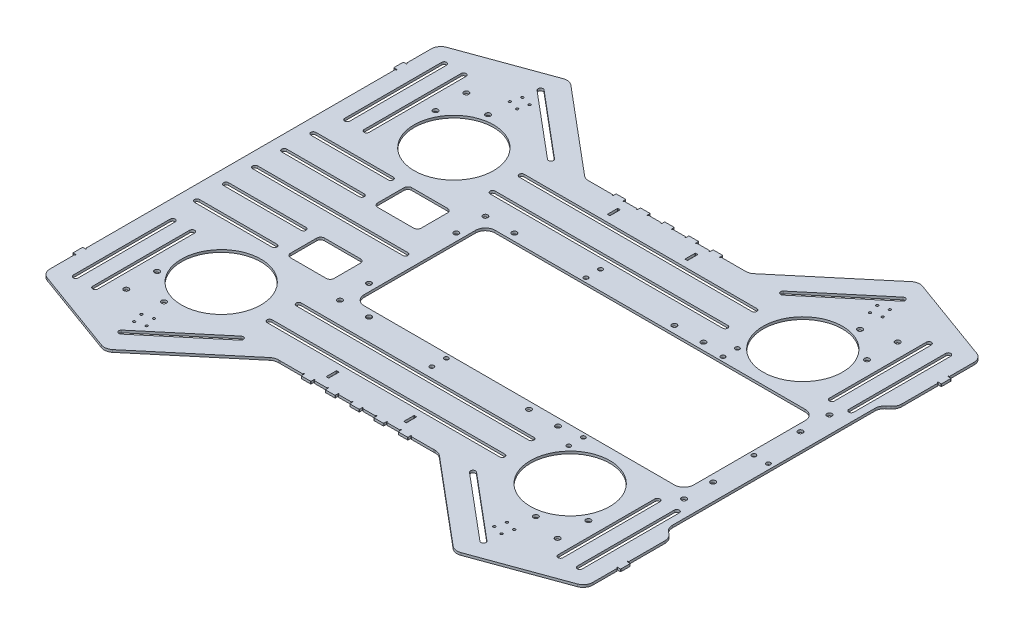
from build123d import *

# Parameters (mm, degrees)
SKETCH1_R                         = 1.575
SKETCH1_R_2                       = 52.07
SHEET_METAL_EXTRUDE_DEPTH         = 3.175
SHAPE_FILLET_R                    = 12.7
SKETCH2_R                         = 3.2639
PV_MOUNT_PATTERN_DEPTH            = 468.231899887
SKETCH3_R                         = 3.2639
THRUSTER_MOUNT_HOLE_PATTERN_DEPTH = 468.231899887
SKETCH5_W                         = 12.7
SKETCH5_H                         = 3.175
BOSS_EXTRUDE4_DEPTH               = 3.175
CUT_EXTRUDE3_DEPTH                = 468.231899887
LPATTERN1_COUNT                   = 5
LPATTERN1_PITCH                   = 31.75
MIRROR3_COPY_1_DEPTH              = 468.231899887
MIRROR3_COPY_2_DEPTH              = 468.231899887
MIRROR3_COPY_3_DEPTH              = 468.231899887
MIRROR3_COPY_4_DEPTH              = 468.231899887
FILLET_FOR_CUTTER_2_R             = 0.508
FILLET_FOR_CUTTER_R               = 0.508
CUT_EXTRUDE4_REACH                = 469.232
SKETCH8_W                         = 3.3528
SKETCH8_H                         = 13.716
FILLET3_R                         = 0.508
SKETCH9_W                         = 12.7
SKETCH9_H                         = 3.175
BOSS_EXTRUDE5_DEPTH               = 3.175
CUT_EXTRUDE5_DEPTH                = 3.175
MIRROR5_COPY_1_DEPTH              = 3.175
FILLET5_R                         = 0.508
SIDE_MOUNTING_SLOTS_DEPTH         = 470.652838698
BACK_MOUNTING_SLOTS_DEPTH         = 470.652838698
CUT_EXTRUDE8_DEPTH                = 470.652838698
MIRROR8_COPY_1_DEPTH              = 470.652838698
CUT_EXTRUDE9_DEPTH                = 470.652838698
CUT_EXTRUDE10_DEPTH               = 470.652838698
FILLET6_R                         = 0.254
FILLET6_OF_MIRROR9_R              = 0.254
MIRROR10_START                    = -1
MIRROR10_DEPTH                    = 5
CUT_EXTRUDE11_REACH               = 471.653
SKETCH16_R                        = 2.75
SCALE1_SCALE                      = 0.35


with BuildPart() as part:
    # Sketch1 → Sheet Metal Extrude (new body)
    with BuildSketch(Plane(origin=(0, 0, 0), x_dir=(1, 0, 0), z_dir=(0, 1, 0))):
        Polygon((-355.6, -258.575780248), (-228.6, -304.8), (-107.517834992, -203.2), (107.517834992, -203.2), (228.6, -304.8), (355.6, -258.575780248), (355.6, -149.225), (342.9, -138.568434684), (342.9, 138.568434684), (355.6, 149.225), (355.6, 258.575780248), (228.6, 304.8), (107.517834992, 203.2), (-107.517834992, 203.2), (-228.6, 304.8), (-355.6, 258.575780248), (-355.6, 149.225), (-355.6, -149.225), align=None)
        with Locations((-240.704026872, -254.319069628)):
            Circle(SKETCH1_R, mode=Mode.SUBTRACT)
        with Locations((-227.726785536, -250.841828292)):
            Circle(SKETCH1_R, mode=Mode.SUBTRACT)
        with Locations((-244.181268208, -241.341828292)):
            Circle(SKETCH1_R, mode=Mode.SUBTRACT)
        with Locations((-231.204026872, -237.864586956)):
            Circle(SKETCH1_R, mode=Mode.SUBTRACT)
        with Locations((-228.6, -152.4)):
            Circle(SKETCH1_R_2, mode=Mode.SUBTRACT)
        with Locations((227.726785536, -250.841828292)):
            Circle(SKETCH1_R, mode=Mode.SUBTRACT)
        with Locations((240.704026872, -254.319069628)):
            Circle(SKETCH1_R, mode=Mode.SUBTRACT)
        with Locations((244.181268208, -241.341828292)):
            Circle(SKETCH1_R, mode=Mode.SUBTRACT)
        with Locations((231.204026872, -237.864586956)):
            Circle(SKETCH1_R, mode=Mode.SUBTRACT)
        with Locations((228.6, -152.4)):
            Circle(SKETCH1_R_2, mode=Mode.SUBTRACT)
        with Locations((-228.6, 152.4)):
            Circle(SKETCH1_R_2, mode=Mode.SUBTRACT)
        with Locations((-231.204026872, 237.864586956)):
            Circle(SKETCH1_R, mode=Mode.SUBTRACT)
        with Locations((-244.181268208, 241.341828292)):
            Circle(SKETCH1_R, mode=Mode.SUBTRACT)
        with Locations((-240.704026872, 254.319069628)):
            Circle(SKETCH1_R, mode=Mode.SUBTRACT)
        with Locations((-227.726785536, 250.841828292)):
            Circle(SKETCH1_R, mode=Mode.SUBTRACT)
        with Locations((228.6, 152.4)):
            Circle(SKETCH1_R_2, mode=Mode.SUBTRACT)
        with Locations((231.204026872, 237.864586956)):
            Circle(SKETCH1_R, mode=Mode.SUBTRACT)
        with Locations((244.181268208, 241.341828292)):
            Circle(SKETCH1_R, mode=Mode.SUBTRACT)
        with Locations((227.726785536, 250.841828292)):
            Circle(SKETCH1_R, mode=Mode.SUBTRACT)
        with Locations((240.704026872, 254.319069628)):
            Circle(SKETCH1_R, mode=Mode.SUBTRACT)
    extrude(amount=SHEET_METAL_EXTRUDE_DEPTH)

    # Shape Fillet
    shape_fillet_edges = [part.edges().sort_by_distance(p)[0] for p in [
        (228.6, 1.5875, -304.8),
        (355.6, 1.5875, -258.575780248),
        (355.6, 1.5875, -149.225),
        (342.9, 1.5875, -138.568434684),
        (342.9, 1.5875, 138.568434684),
        (355.6, 1.5875, 149.225),
        (355.6, 1.5875, 258.575780248),
        (228.6, 1.5875, 304.8),
        (107.517834992, 1.5875, 203.2),
        (-107.517834992, 1.5875, 203.2),
        (-228.6, 1.5875, 304.8),
        (-355.6, 1.5875, 258.575780248),
        (-355.6, 1.5875, -258.575780248),
        (-228.6, 1.5875, -304.8),
        (-107.517834992, 1.5875, -203.2),
        (107.517834992, 1.5875, -203.2),
    ]]
    fillet(shape_fillet_edges, radius=SHAPE_FILLET_R)

    # Sketch2 → PV Mount Pattern (cut, through all)
    with BuildSketch(Plane(origin=(0, 3.175, 0), x_dir=(1, 0, 0), z_dir=(0, 1, 0))):
        with Locations(Location((320.675, 95.25, 0), (0, 0, 270))):
            Circle(SKETCH2_R)
        with Locations(Location((320.675, 57.15, 0), (0, 0, 270))):
            Circle(SKETCH2_R)
        with Locations(Location((155.575, 95.25, 0), (0, 0, 270))):
            Circle(SKETCH2_R)
        with Locations(Location((117.475, 95.25, 0), (0, 0, 270))):
            Circle(SKETCH2_R)
        with Locations(Location((-92.075, 95.25, 0), (0, 0, 270))):
            Circle(SKETCH2_R)
        with Locations(Location((-130.175, 95.25, 0), (0, 0, 270))):
            Circle(SKETCH2_R)
        with Locations(Location((-130.175, 57.15, 0), (0, 0, 270))):
            Circle(SKETCH2_R)
        with Locations(Location((320.675, -57.15, 0), (0, 0, 90))):
            Circle(SKETCH2_R)
        with Locations(Location((320.675, -95.25, 0), (0, 0, 90))):
            Circle(SKETCH2_R)
        with Locations(Location((155.575, -95.25, 0), (0, 0, 90))):
            Circle(SKETCH2_R)
        with Locations(Location((117.475, -95.25, 0), (0, 0, 90))):
            Circle(SKETCH2_R)
        with Locations(Location((-92.075, -95.25, 0), (0, 0, 90))):
            Circle(SKETCH2_R)
        with Locations(Location((-130.175, -95.25, 0), (0, 0, 90))):
            Circle(SKETCH2_R)
        with Locations(Location((-130.175, -57.15, 0), (0, 0, 90))):
            Circle(SKETCH2_R)
        with BuildLine():
            Line((-107.95, 85.725), (298.45, 85.725))
            ThreePointArc((298.45, 85.725), (307.430256121, 82.005256121), (311.15, 73.025))
            Line((311.15, 73.025), (311.15, -73.025))
            ThreePointArc((311.15, -73.025), (307.430256121, -82.005256121), (298.45, -85.725))
            Line((298.45, -85.725), (-107.95, -85.725))
            ThreePointArc((-107.95, -85.725), (-116.930256121, -82.005256121), (-120.65, -73.025))
            Line((-120.65, -73.025), (-120.65, 73.025))
            ThreePointArc((-120.65, 73.025), (-116.930256121, 82.005256121), (-107.95, 85.725))
        make_face()
    extrude(amount=-PV_MOUNT_PATTERN_DEPTH, mode=Mode.SUBTRACT)

    # Sketch3 → Thruster Mount Hole Pattern (cut, through all)
    with BuildSketch(Plane(origin=(0, 3.175, 0), x_dir=(1, 0, 0), z_dir=(0, 1, 0))):
        with Locations(Location((282.589529262, 222.760524402, 0), (0, 0, 270))):
            Circle(SKETCH3_R)
        with Locations(Location((-282.589529262, 222.760524402, 0), (0, 0, 270))):
            Circle(SKETCH3_R)
        with Locations(Location((282.589529262, -222.760524402, 0), (0, 0, 90))):
            Circle(SKETCH3_R)
        with Locations(Location((-282.589529262, -222.760524402, 0), (0, 0, 90))):
            Circle(SKETCH3_R)
        with Locations(Location((282.589529262, 182.458174715, 0), (0, 0, 270))):
            Circle(SKETCH3_R)
        with Locations(Location((243.660448839, 212.329508741, 0), (0, 0, 270))):
            Circle(SKETCH3_R)
        with Locations(Location((-243.660448839, 212.329508741, 0), (0, 0, 270))):
            Circle(SKETCH3_R)
        with Locations(Location((-282.589529262, 182.458174715, 0), (0, 0, 270))):
            Circle(SKETCH3_R)
        with Locations(Location((243.660448839, -212.329508741, 0), (0, 0, 90))):
            Circle(SKETCH3_R)
        with Locations(Location((282.589529262, -182.458174715, 0), (0, 0, 90))):
            Circle(SKETCH3_R)
        with Locations(Location((-282.589529262, -182.458174715, 0), (0, 0, 90))):
            Circle(SKETCH3_R)
        with Locations(Location((-243.660448839, -212.329508741, 0), (0, 0, 90))):
            Circle(SKETCH3_R)
    extrude(amount=-THRUSTER_MOUNT_HOLE_PATTERN_DEPTH, mode=Mode.SUBTRACT)

    # Sketch5 → Boss-Extrude4 (add)
    with BuildSketch(Plane.XY.offset(203.2)):
        with Locations((0, 1.5875)):
            Rectangle(SKETCH5_W, SKETCH5_H)
        with Locations((31.75, 1.5875)):
            Rectangle(SKETCH5_W, SKETCH5_H)
        with Locations((63.5, 1.5875)):
            Rectangle(SKETCH5_W, SKETCH5_H)
        with Locations((-31.75, 1.5875)):
            Rectangle(SKETCH5_W, SKETCH5_H)
        with Locations((-63.5, 1.5875)):
            Rectangle(SKETCH5_W, SKETCH5_H)
    boss_extrude4 = extrude(amount=BOSS_EXTRUDE4_DEPTH)

    # Mirror2: Boss-Extrude4 across plane
    add(boss_extrude4.mirror(Plane.XY))

    # Sketch6 → Cut-Extrude3 (cut, through all)
    with BuildSketch(Plane(origin=(0, 3.175, 0), x_dir=(1, 0, 0), z_dir=(0, 1, 0))):
        with BuildLine():
            Line((69.85, 202.438), (69.85, 203.2))
            Line((69.85, 203.2), (70.866, 203.2))
            Line((70.866, 203.2), (70.866, 202.438))
            ThreePointArc((70.866, 202.438), (70.358, 201.93), (69.85, 202.438))
        make_face()
        with BuildLine():
            Line((56.134, 202.438), (56.134, 203.2))
            Line((56.134, 203.2), (57.15, 203.2))
            Line((57.15, 203.2), (57.15, 202.438))
            ThreePointArc((57.15, 202.438), (56.642, 201.93), (56.134, 202.438))
        make_face()
    cut_extrude3 = extrude(amount=-CUT_EXTRUDE3_DEPTH, mode=Mode.SUBTRACT)

    # LPattern1: Cut-Extrude3 ×5
    with Locations(*[(-i * LPATTERN1_PITCH, 0, 0) for i in range(1, LPATTERN1_COUNT)]):
        add(cut_extrude3, mode=Mode.SUBTRACT)

    # Mirror3: Cut-Extrude3 across plane
    add(cut_extrude3.mirror(Plane.XY), mode=Mode.SUBTRACT)

    # Mirror3 copy 1 sketch → Mirror3 copy 1 (cut, through all)
    with BuildSketch(Plane(origin=(-31.75, 3.175, 0), x_dir=(1, 0, 0), z_dir=(0, 1, 0))):
        with BuildLine():
            Line((69.85, -202.438), (69.85, -203.2))
            Line((69.85, -203.2), (70.866, -203.2))
            Line((70.866, -203.2), (70.866, -202.438))
            ThreePointArc((70.866, -202.438), (70.358, -201.93), (69.85, -202.438))
        make_face()
        with BuildLine():
            Line((56.134, -202.438), (56.134, -203.2))
            Line((56.134, -203.2), (57.15, -203.2))
            Line((57.15, -203.2), (57.15, -202.438))
            ThreePointArc((57.15, -202.438), (56.642, -201.93), (56.134, -202.438))
        make_face()
    extrude(amount=-MIRROR3_COPY_1_DEPTH, mode=Mode.SUBTRACT)

    # Mirror3 copy 2 sketch → Mirror3 copy 2 (cut, through all)
    with BuildSketch(Plane(origin=(-63.5, 3.175, 0), x_dir=(1, 0, 0), z_dir=(0, 1, 0))):
        with BuildLine():
            Line((69.85, -202.438), (69.85, -203.2))
            Line((69.85, -203.2), (70.866, -203.2))
            Line((70.866, -203.2), (70.866, -202.438))
            ThreePointArc((70.866, -202.438), (70.358, -201.93), (69.85, -202.438))
        make_face()
        with BuildLine():
            Line((56.134, -202.438), (56.134, -203.2))
            Line((56.134, -203.2), (57.15, -203.2))
            Line((57.15, -203.2), (57.15, -202.438))
            ThreePointArc((57.15, -202.438), (56.642, -201.93), (56.134, -202.438))
        make_face()
    extrude(amount=-MIRROR3_COPY_2_DEPTH, mode=Mode.SUBTRACT)

    # Mirror3 copy 3 sketch → Mirror3 copy 3 (cut, through all)
    with BuildSketch(Plane(origin=(-95.25, 3.175, 0), x_dir=(1, 0, 0), z_dir=(0, 1, 0))):
        with BuildLine():
            Line((69.85, -202.438), (69.85, -203.2))
            Line((69.85, -203.2), (70.866, -203.2))
            Line((70.866, -203.2), (70.866, -202.438))
            ThreePointArc((70.866, -202.438), (70.358, -201.93), (69.85, -202.438))
        make_face()
        with BuildLine():
            Line((56.134, -202.438), (56.134, -203.2))
            Line((56.134, -203.2), (57.15, -203.2))
            Line((57.15, -203.2), (57.15, -202.438))
            ThreePointArc((57.15, -202.438), (56.642, -201.93), (56.134, -202.438))
        make_face()
    extrude(amount=-MIRROR3_COPY_3_DEPTH, mode=Mode.SUBTRACT)

    # Mirror3 copy 4 sketch → Mirror3 copy 4 (cut, through all)
    with BuildSketch(Plane(origin=(-127, 3.175, 0), x_dir=(1, 0, 0), z_dir=(0, 1, 0))):
        with BuildLine():
            Line((69.85, -202.438), (69.85, -203.2))
            Line((69.85, -203.2), (70.866, -203.2))
            Line((70.866, -203.2), (70.866, -202.438))
            ThreePointArc((70.866, -202.438), (70.358, -201.93), (69.85, -202.438))
        make_face()
        with BuildLine():
            Line((56.134, -202.438), (56.134, -203.2))
            Line((56.134, -203.2), (57.15, -203.2))
            Line((57.15, -203.2), (57.15, -202.438))
            ThreePointArc((57.15, -202.438), (56.642, -201.93), (56.134, -202.438))
        make_face()
    extrude(amount=-MIRROR3_COPY_4_DEPTH, mode=Mode.SUBTRACT)

    # Fillet for Cutter 2
    fillet_for_cutter_2_edges = [part.edges().sort_by_distance(p)[0] for p in [
        (-6.35, 1.5875, 206.375),
        (6.35, 1.5875, 206.375),
        (-38.1, 1.5875, 206.375),
        (-25.4, 1.5875, 206.375),
        (25.4, 1.5875, 206.375),
        (38.1, 1.5875, 206.375),
        (57.15, 1.5875, 206.375),
        (69.85, 1.5875, 206.375),
        (-69.85, 1.5875, 206.375),
        (-57.15, 1.5875, 206.375),
        (70.866, 1.5875, 203.2),
        (56.134, 1.5875, 203.2),
        (39.116, 1.5875, 203.2),
        (24.384, 1.5875, 203.2),
        (7.366, 1.5875, 203.2),
        (-7.366, 1.5875, 203.2),
        (-24.384, 1.5875, 203.2),
        (-39.116, 1.5875, 203.2),
        (-56.134, 1.5875, 203.2),
        (-70.866, 1.5875, 203.2),
    ]]
    fillet(fillet_for_cutter_2_edges, radius=FILLET_FOR_CUTTER_2_R)

    # Fillet for Cutter
    fillet_for_cutter_edges = [part.edges().sort_by_distance(p)[0] for p in [
        (-6.35, 1.5875, -206.375),
        (6.35, 1.5875, -206.375),
        (-25.4, 1.5875, -206.375),
        (-38.1, 1.5875, -206.375),
        (38.1, 1.5875, -206.375),
        (25.4, 1.5875, -206.375),
        (69.85, 1.5875, -206.375),
        (57.15, 1.5875, -206.375),
        (-57.15, 1.5875, -206.375),
        (-69.85, 1.5875, -206.375),
        (70.866, 1.5875, -203.2),
        (56.134, 1.5875, -203.2),
        (39.116, 1.5875, -203.2),
        (24.384, 1.5875, -203.2),
        (-7.366, 1.5875, -203.2),
        (-24.384, 1.5875, -203.2),
        (-39.116, 1.5875, -203.2),
        (-56.134, 1.5875, -203.2),
        (-70.866, 1.5875, -203.2),
    ]]
    fillet(fillet_for_cutter_edges, radius=FILLET_FOR_CUTTER_R)

    # Sketch8 → Cut-Extrude4 (cut, up to next)
    with BuildSketch(Plane(origin=(0, 3.175, 0), x_dir=(1, 0, 0), z_dir=(0, 1, 0)), mode=Mode.PRIVATE) as cut_extrude4_sk1:
        with Locations((50.8, 184.15)):
            Rectangle(SKETCH8_W, SKETCH8_H)
    cut_extrude4_tool1 = extrude(cut_extrude4_sk1.sketch, amount=-CUT_EXTRUDE4_REACH, mode=Mode.PRIVATE) & part.part
    # Sketch8 → Cut-Extrude4 (cut, up to next)
    with BuildSketch(Plane(origin=(0, 3.175, 0), x_dir=(1, 0, 0), z_dir=(0, 1, 0)), mode=Mode.PRIVATE) as cut_extrude4_sk2:
        with Locations((-50.8, 184.15)):
            Rectangle(SKETCH8_W, SKETCH8_H)
    cut_extrude4_tool2 = extrude(cut_extrude4_sk2.sketch, amount=-CUT_EXTRUDE4_REACH, mode=Mode.PRIVATE) & part.part
    # Sketch8 → Cut-Extrude4 (cut, up to next)
    with BuildSketch(Plane(origin=(0, 3.175, 0), x_dir=(1, 0, 0), z_dir=(0, 1, 0)), mode=Mode.PRIVATE) as cut_extrude4_sk3:
        with Locations((-50.8, -184.15)):
            Rectangle(SKETCH8_W, SKETCH8_H)
    cut_extrude4_tool3 = extrude(cut_extrude4_sk3.sketch, amount=-CUT_EXTRUDE4_REACH, mode=Mode.PRIVATE) & part.part
    # Sketch8 → Cut-Extrude4 (cut, up to next)
    with BuildSketch(Plane(origin=(0, 3.175, 0), x_dir=(1, 0, 0), z_dir=(0, 1, 0)), mode=Mode.PRIVATE) as cut_extrude4_sk4:
        with Locations((50.8, -184.15)):
            Rectangle(SKETCH8_W, SKETCH8_H)
    cut_extrude4_tool4 = extrude(cut_extrude4_sk4.sketch, amount=-CUT_EXTRUDE4_REACH, mode=Mode.PRIVATE) & part.part
    add(cut_extrude4_tool1.solids().sort_by_distance((50.8, 3.175, -184.15))[0], mode=Mode.SUBTRACT)
    add(cut_extrude4_tool2.solids().sort_by_distance((-50.8, 3.175, -184.15))[0], mode=Mode.SUBTRACT)
    add(cut_extrude4_tool3.solids().sort_by_distance((-50.8, 3.175, 184.15))[0], mode=Mode.SUBTRACT)
    add(cut_extrude4_tool4.solids().sort_by_distance((50.8, 3.175, 184.15))[0], mode=Mode.SUBTRACT)

    # Fillet3
    fillet3_edges = [part.edges().sort_by_distance(p)[0] for p in [
        (52.4764, 1.5875, 177.292),
        (52.4764, 1.5875, 191.008),
        (49.1236, 1.5875, 191.008),
        (49.1236, 1.5875, 177.292),
        (-52.4764, 1.5875, 191.008),
        (-52.4764, 1.5875, 177.292),
        (-49.1236, 1.5875, 177.292),
        (-49.1236, 1.5875, 191.008),
        (-52.4764, 1.5875, -177.292),
        (-52.4764, 1.5875, -191.008),
        (-49.1236, 1.5875, -191.008),
        (-49.1236, 1.5875, -177.292),
        (49.1236, 1.5875, -177.292),
        (49.1236, 1.5875, -191.008),
        (52.4764, 1.5875, -191.008),
        (52.4764, 1.5875, -177.292),
    ]]
    fillet(fillet3_edges, radius=FILLET3_R)

    # Sketch9 → Boss-Extrude5 (add)
    with BuildSketch(Plane(origin=(355.6, 0, 0), x_dir=(0, 0, -1), z_dir=(1, 0, 0))):
        with Locations((210.058, 1.5875)):
            Rectangle(SKETCH9_W, SKETCH9_H)
        with Locations((-210.058, 1.5875)):
            Rectangle(SKETCH9_W, SKETCH9_H)
    boss_extrude5 = extrude(amount=BOSS_EXTRUDE5_DEPTH)

    # Sketch10 → Cut-Extrude5 (cut)
    with BuildSketch(Plane(origin=(0, 3.175, 0), x_dir=(1, 0, 0), z_dir=(0, 1, 0))):
        with BuildLine():
            Line((354.838, -217.424), (355.6, -217.424))
            Line((355.6, -217.424), (355.6, -216.408))
            Line((355.6, -216.408), (354.838, -216.408))
            ThreePointArc((354.838, -216.408), (354.33, -216.916), (354.838, -217.424))
        make_face()
        with BuildLine():
            Line((354.838, -202.692), (355.6, -202.692))
            Line((355.6, -202.692), (355.6, -203.708))
            Line((355.6, -203.708), (354.838, -203.708))
            ThreePointArc((354.838, -203.708), (354.33, -203.2), (354.838, -202.692))
        make_face()
    cut_extrude5 = extrude(amount=-CUT_EXTRUDE5_DEPTH, mode=Mode.SUBTRACT)

    # Mirror4: Cut-Extrude5 across plane
    add(cut_extrude5.mirror(Plane.XY), mode=Mode.SUBTRACT)

    # Mirror5: Boss-Extrude5, Cut-Extrude5 across plane
    add(boss_extrude5.mirror(Plane(origin=(0, 0, 0), x_dir=(0, 0, 1), z_dir=(1, 0, 0))))
    add(cut_extrude5.mirror(Plane(origin=(0, 0, 0), x_dir=(0, 0, 1), z_dir=(1, 0, 0))), mode=Mode.SUBTRACT)

    # Mirror5 copy 1 sketch → Mirror5 copy 1 (cut)
    with BuildSketch(Plane(origin=(0, 3.175, 0), x_dir=(-1, 0, 0), z_dir=(0, 1, 0))):
        with BuildLine():
            Line((354.838, -217.424), (355.6, -217.424))
            Line((355.6, -217.424), (355.6, -216.408))
            Line((355.6, -216.408), (354.838, -216.408))
            ThreePointArc((354.838, -216.408), (354.33, -216.916), (354.838, -217.424))
        make_face()
        with BuildLine():
            Line((354.838, -202.692), (355.6, -202.692))
            Line((355.6, -202.692), (355.6, -203.708))
            Line((355.6, -203.708), (354.838, -203.708))
            ThreePointArc((354.838, -203.708), (354.33, -203.2), (354.838, -202.692))
        make_face()
    extrude(amount=-MIRROR5_COPY_1_DEPTH, mode=Mode.SUBTRACT)

    # Fillet5
    fillet5_edges = [part.edges().sort_by_distance(p)[0] for p in [
        (358.775, 1.5875, -203.708),
        (358.775, 1.5875, -216.408),
        (358.775, 1.5875, 216.408),
        (358.775, 1.5875, 203.708),
        (355.6, 1.5875, 217.424),
        (355.6, 1.5875, 202.692),
        (355.6, 1.5875, -217.424),
        (355.6, 1.5875, -202.692),
        (-358.775, 1.5875, -203.708),
        (-358.775, 1.5875, -216.408),
        (-358.775, 1.5875, 203.708),
        (-358.775, 1.5875, 216.408),
        (-355.6, 1.5875, 217.424),
        (-355.6, 1.5875, 202.692),
        (-355.6, 1.5875, -217.424),
        (-355.6, 1.5875, -202.692),
    ]]
    fillet(fillet5_edges, radius=FILLET5_R)

    # Sketch11 → Side Mounting Slots (cut, through all)
    with BuildSketch(Plane(origin=(0, 3.175, 0), x_dir=(1, 0, 0), z_dir=(0, 1, 0))):
        with BuildLine():
            Line((152.4, 168.3639), (-152.4, 168.3639))
            ThreePointArc((-152.4, 168.3639), (-155.6639, 165.1), (-152.4, 161.8361))
            Line((-152.4, 161.8361), (152.4, 161.8361))
            ThreePointArc((152.4, 161.8361), (155.6639, 165.1), (152.4, 168.3639))
        make_face()
        with BuildLine():
            Line((-152.4, 123.7361), (152.4, 123.7361))
            ThreePointArc((152.4, 123.7361), (155.6639, 127), (152.4, 130.2639))
            Line((152.4, 130.2639), (-152.4, 130.2639))
            ThreePointArc((-152.4, 130.2639), (-155.6639, 127), (-152.4, 123.7361))
        make_face()
    side_mounting_slots = extrude(amount=-SIDE_MOUNTING_SLOTS_DEPTH, mode=Mode.SUBTRACT)

    # Mirror6: Side Mounting Slots across plane
    add(side_mounting_slots.mirror(Plane.XY), mode=Mode.SUBTRACT)

    # Sketch12 → Back Mounting Slots (cut, through all)
    with BuildSketch(Plane(origin=(0, 3.175, 0), x_dir=(1, 0, 0), z_dir=(0, 1, 0))):
        with BuildLine():
            Line((-139.7, -3.2639), (-336.55, -3.2639))
            ThreePointArc((-336.55, -3.2639), (-339.8139, 0), (-336.55, 3.2639))
            Line((-336.55, 3.2639), (-139.7, 3.2639))
            ThreePointArc((-139.7, 3.2639), (-136.4361, 0), (-139.7, -3.2639))
        make_face()
        with BuildLine():
            Line((-215.9, -74.3839), (-215.9, -39.9161))
            ThreePointArc((-215.9, -39.9161), (-214.412102448, -36.323997552), (-210.82, -34.8361))
            Line((-210.82, -34.8361), (-163.83, -34.8361))
            ThreePointArc((-163.83, -34.8361), (-160.237897552, -36.323997552), (-158.75, -39.9161))
            Line((-158.75, -39.9161), (-158.75, -74.3839))
            ThreePointArc((-158.75, -74.3839), (-160.237897552, -77.976002448), (-163.83, -79.4639))
            Line((-163.83, -79.4639), (-210.82, -79.4639))
            ThreePointArc((-210.82, -79.4639), (-214.412102448, -77.976002448), (-215.9, -74.3839))
        make_face()
        with BuildLine():
            Line((-336.55, 41.3639), (-234.95, 41.3639))
            ThreePointArc((-234.95, 41.3639), (-231.6861, 38.1), (-234.95, 34.8361))
            Line((-234.95, 34.8361), (-336.55, 34.8361))
            ThreePointArc((-336.55, 34.8361), (-339.8139, 38.1), (-336.55, 41.3639))
        make_face()
        with BuildLine():
            Line((-336.55, 79.4639), (-234.95, 79.4639))
            ThreePointArc((-234.95, 79.4639), (-231.6861, 76.2), (-234.95, 72.9361))
            Line((-234.95, 72.9361), (-336.55, 72.9361))
            ThreePointArc((-336.55, 72.9361), (-339.8139, 76.2), (-336.55, 79.4639))
        make_face()
        with BuildLine():
            Line((-336.55, -41.3639), (-234.95, -41.3639))
            ThreePointArc((-234.95, -41.3639), (-231.6861, -38.1), (-234.95, -34.8361))
            Line((-234.95, -34.8361), (-336.55, -34.8361))
            ThreePointArc((-336.55, -34.8361), (-339.8139, -38.1), (-336.55, -41.3639))
        make_face()
        with BuildLine():
            Line((-336.55, -72.9361), (-234.95, -72.9361))
            ThreePointArc((-234.95, -72.9361), (-231.6861, -76.2), (-234.95, -79.4639))
            Line((-234.95, -79.4639), (-336.55, -79.4639))
            ThreePointArc((-336.55, -79.4639), (-339.8139, -76.2), (-336.55, -72.9361))
        make_face()
        with BuildLine():
            Line((-163.83, 79.4639), (-210.82, 79.4639))
            ThreePointArc((-210.82, 79.4639), (-214.412102448, 77.976002448), (-215.9, 74.3839))
            Line((-215.9, 74.3839), (-215.9, 39.9161))
            ThreePointArc((-215.9, 39.9161), (-214.412102448, 36.323997552), (-210.82, 34.8361))
            Line((-210.82, 34.8361), (-163.83, 34.8361))
            ThreePointArc((-163.83, 34.8361), (-160.237897552, 36.323997552), (-158.75, 39.9161))
            Line((-158.75, 39.9161), (-158.75, 74.3839))
            ThreePointArc((-158.75, 74.3839), (-160.237897552, 77.976002448), (-163.83, 79.4639))
        make_face()
    extrude(amount=-BACK_MOUNTING_SLOTS_DEPTH, mode=Mode.SUBTRACT)

    # Sketch13 → Cut-Extrude8 (cut, through all)
    with BuildSketch(Plane.XZ):
        with BuildLine():
            Line((-326.9361, 241.3), (-326.9361, 114.3))
            ThreePointArc((-326.9361, 114.3), (-330.2, 111.0361), (-333.4639, 114.3))
            Line((-333.4639, 114.3), (-333.4639, 241.3))
            ThreePointArc((-333.4639, 241.3), (-330.2, 244.5639), (-326.9361, 241.3))
        make_face()
        with BuildLine():
            Line((-308.0639, 241.3), (-308.0639, 114.3))
            ThreePointArc((-308.0639, 114.3), (-304.8, 111.0361), (-301.5361, 114.3))
            Line((-301.5361, 114.3), (-301.5361, 241.3))
            ThreePointArc((-301.5361, 241.3), (-304.8, 244.5639), (-308.0639, 241.3))
        make_face()
    cut_extrude8 = extrude(amount=-CUT_EXTRUDE8_DEPTH, mode=Mode.SUBTRACT)

    # Mirror7: Cut-Extrude8 across plane
    add(cut_extrude8.mirror(Plane(origin=(0, 0, 0), x_dir=(0, 0, 1), z_dir=(1, 0, 0))), mode=Mode.SUBTRACT)

    # Mirror8: Cut-Extrude8 across plane
    add(cut_extrude8.mirror(Plane.XY), mode=Mode.SUBTRACT)

    # Mirror8 copy 1 sketch → Mirror8 copy 1 (cut, through all)
    with BuildSketch(Plane(origin=(0, 0, 0), x_dir=(-1, 0, 0), z_dir=(0, -1, 0))):
        with BuildLine():
            Line((-326.9361, 241.3), (-326.9361, 114.3))
            ThreePointArc((-326.9361, 114.3), (-330.2, 111.0361), (-333.4639, 114.3))
            Line((-333.4639, 114.3), (-333.4639, 241.3))
            ThreePointArc((-333.4639, 241.3), (-330.2, 244.5639), (-326.9361, 241.3))
        make_face()
        with BuildLine():
            Line((-308.0639, 241.3), (-308.0639, 114.3))
            ThreePointArc((-308.0639, 114.3), (-304.8, 111.0361), (-301.5361, 114.3))
            Line((-301.5361, 114.3), (-301.5361, 241.3))
            ThreePointArc((-301.5361, 241.3), (-304.8, 244.5639), (-308.0639, 241.3))
        make_face()
    extrude(amount=-MIRROR8_COPY_1_DEPTH, mode=Mode.SUBTRACT)

    # Sketch14 → Cut-Extrude9 (cut, through all)
    with BuildSketch(Plane(origin=(0, 0, 0), x_dir=(-1, 0, 0), z_dir=(0, -1, 0))):
        with BuildLine():
            Line((-235.136540287, 277.127463395), (-150.012952714, 205.700292458))
            ThreePointArc((-150.012952714, 205.700292458), (-149.610654735, 201.102005521), (-154.208941672, 200.699707542))
            Line((-154.208941672, 200.699707542), (-239.332529246, 272.126878479))
            ThreePointArc((-239.332529246, 272.126878479), (-239.734827224, 276.725165417), (-235.136540287, 277.127463395))
        make_face()
        with BuildLine():
            Line((-239.332529246, -272.126878479), (-154.208941672, -200.699707542))
            ThreePointArc((-154.208941672, -200.699707542), (-149.610654735, -201.102005521), (-150.012952714, -205.700292458))
            Line((-150.012952714, -205.700292458), (-235.136540287, -277.127463395))
            ThreePointArc((-235.136540287, -277.127463395), (-239.734827224, -276.725165417), (-239.332529246, -272.126878479))
        make_face()
        with BuildLine():
            Line((235.136540287, -277.127463395), (150.012952714, -205.700292458))
            ThreePointArc((150.012952714, -205.700292458), (149.610654735, -201.102005521), (154.208941672, -200.699707542))
            Line((154.208941672, -200.699707542), (239.332529246, -272.126878479))
            ThreePointArc((239.332529246, -272.126878479), (239.734827224, -276.725165417), (235.136540287, -277.127463395))
        make_face()
        with BuildLine():
            Line((239.332529246, 272.126878479), (154.208941672, 200.699707542))
            ThreePointArc((154.208941672, 200.699707542), (149.610654735, 201.102005521), (150.012952714, 205.700292458))
            Line((150.012952714, 205.700292458), (235.136540287, 277.127463395))
            ThreePointArc((235.136540287, 277.127463395), (239.734827224, 276.725165417), (239.332529246, 272.126878479))
        make_face()
    extrude(amount=-CUT_EXTRUDE9_DEPTH, mode=Mode.SUBTRACT)

    # Sketch15 → Cut-Extrude10 (cut, through all)
    with BuildSketch(Plane(origin=(0, 3.175, 0), x_dir=(1, 0, 0), z_dir=(0, 1, 0))):
        Polygon((100.084767464, 203.2), (101.608767464, 202.9968), (101.608767464, 203.2), align=None)
    cut_extrude10 = extrude(amount=-CUT_EXTRUDE10_DEPTH, mode=Mode.SUBTRACT)

    # Fillet6
    # the kernel refuses this fillet: 0.254 mm, written as the material it adds along each edge
    with BuildSketch(Plane(origin=(101.608767464, 3.175, -202.9968), x_dir=(-0.9912279006826319, 0, -0.13216372009103824), z_dir=(0, -1, 0))) as fillet6_piece_1:
        with BuildLine():
            CenterArc((0.275353317, 0.254), FILLET6_R, 191.947637647, 78.052362353)
            Line((0.026855668, 0.201417509), (0.021885715, 0.20036586))
            ThreePointArc((0.021885715, 0.20036586), (0.008392396, 0.101380146), (-0.005035438, 0.000671392))
            Line((-0.005035438, 0.000671392), (0, -0.00508))
            Line((0, -0.00508), (0.275353317, -0.00508))
            Line((0.275353317, -0.00508), (0.275353317, 0))
        make_face()
    extrude(amount=3.175)

    # Mirror9: Cut-Extrude10 across plane
    add(cut_extrude10.mirror(Plane.XY), mode=Mode.SUBTRACT)

    # Fillet6 of Mirror9
    # the kernel refuses this fillet: 0.254 mm, written as the material it adds along each edge
    with BuildSketch(Plane(origin=(101.608767464, 3.175, 202.9968), x_dir=(0, 0, 1), z_dir=(0, -1, 0))) as fillet6_of_mirror9_piece_1:
        with BuildLine():
            CenterArc((0.288163606, 0.239368306), FILLET6_OF_MIRROR9_R, 172.405356631, 78.052362353)
            Line((0.036391719, 0.272937891), (0.031356281, 0.273609282))
            Line((0.031356281, 0.273609282), (-0.005035438, 0.000671392))
            Line((-0.005035438, 0.000671392), (0, -0.00508))
            ThreePointArc((0, -0.00508), (0.1016, -0.00508), (0.201500728, -0.004787366))
            Line((0.201500728, -0.004787366), (0.2032, 0))
        make_face()
    extrude(amount=3.175)

    # Mirror10: read off the stored shape, not the designer's step
    # Mirror10 outline → Mirror10 (cut)
    with BuildSketch(Plane(origin=(0, 0, 0), x_dir=(1, 0, 0), z_dir=(0, 1, 0)).offset(MIRROR10_START)):
        with BuildLine():
            Line((-101.335829573, 203.033191719), (-100.084767464, 203.2))
            Line((-100.084767464, 203.2), (-101.608767464, 203.2))
            ThreePointArc((-101.608767464, 203.2), (-101.501854921, 203.068234579), (-101.335829573, 203.033191719))
        make_face()
        with BuildLine():
            Line((-101.608767464, -203.2), (-100.084767464, -203.2))
            Line((-100.084767464, -203.2), (-101.335829573, -203.033191719))
            ThreePointArc((-101.335829573, -203.033191719), (-101.501854921, -203.068234579), (-101.608767464, -203.2))
        make_face()
    extrude(amount=MIRROR10_DEPTH, mode=Mode.SUBTRACT)

    # Sketch16 → Cut-Extrude11 (cut, up to next)
    with BuildSketch(Plane(origin=(0, 0, 0), x_dir=(-1, 0, 0), z_dir=(0, -1, 0)), mode=Mode.PRIVATE) as cut_extrude11_sk1:
        with Locations(Location((-184.888055827, 91.458807626, 0), (0, 0, 90))):
            Circle(SKETCH16_R)
    cut_extrude11_tool1 = extrude(cut_extrude11_sk1.sketch, amount=-CUT_EXTRUDE11_REACH, mode=Mode.PRIVATE) & part.part
    # Sketch16 → Cut-Extrude11 (cut, up to next)
    with BuildSketch(Plane(origin=(0, 0, 0), x_dir=(-1, 0, 0), z_dir=(0, -1, 0)), mode=Mode.PRIVATE) as cut_extrude11_sk2:
        with Locations(Location((-184.888055827, 110.508807626, 0), (0, 0, 90))):
            Circle(SKETCH16_R)
    cut_extrude11_tool2 = extrude(cut_extrude11_sk2.sketch, amount=-CUT_EXTRUDE11_REACH, mode=Mode.PRIVATE) & part.part
    # Sketch16 → Cut-Extrude11 (cut, up to next)
    with BuildSketch(Plane(origin=(0, 0, 0), x_dir=(-1, 0, 0), z_dir=(0, -1, 0)), mode=Mode.PRIVATE) as cut_extrude11_sk3:
        with Locations(Location((-335.933807626, 0, 0), (0, 0, 90))):
            Circle(SKETCH16_R)
    cut_extrude11_tool3 = extrude(cut_extrude11_sk3.sketch, amount=-CUT_EXTRUDE11_REACH, mode=Mode.PRIVATE) & part.part
    # Sketch16 → Cut-Extrude11 (cut, up to next)
    with BuildSketch(Plane(origin=(0, 0, 0), x_dir=(-1, 0, 0), z_dir=(0, -1, 0)), mode=Mode.PRIVATE) as cut_extrude11_sk4:
        with Locations(Location((-316.883807626, 0, 0), (0, 0, 90))):
            Circle(SKETCH16_R)
    cut_extrude11_tool4 = extrude(cut_extrude11_sk4.sketch, amount=-CUT_EXTRUDE11_REACH, mode=Mode.PRIVATE) & part.part
    # Sketch16 → Cut-Extrude11 (cut, up to next)
    with BuildSketch(Plane(origin=(0, 0, 0), x_dir=(-1, 0, 0), z_dir=(0, -1, 0)), mode=Mode.PRIVATE) as cut_extrude11_sk5:
        with Locations(Location((-184.888055827, -110.508807626, 0), (0, 0, 90))):
            Circle(SKETCH16_R)
    cut_extrude11_tool5 = extrude(cut_extrude11_sk5.sketch, amount=-CUT_EXTRUDE11_REACH, mode=Mode.PRIVATE) & part.part
    # Sketch16 → Cut-Extrude11 (cut, up to next)
    with BuildSketch(Plane(origin=(0, 0, 0), x_dir=(-1, 0, 0), z_dir=(0, -1, 0)), mode=Mode.PRIVATE) as cut_extrude11_sk6:
        with Locations(Location((-184.888055827, -91.458807626, 0), (0, 0, 90))):
            Circle(SKETCH16_R)
    cut_extrude11_tool6 = extrude(cut_extrude11_sk6.sketch, amount=-CUT_EXTRUDE11_REACH, mode=Mode.PRIVATE) & part.part
    # Sketch16 → Cut-Extrude11 (cut, up to next)
    with BuildSketch(Plane(origin=(0, 0, 0), x_dir=(-1, 0, 0), z_dir=(0, -1, 0)), mode=Mode.PRIVATE) as cut_extrude11_sk7:
        with Locations(Location((-5.449027914, -110.508807626, 0), (0, 0, 90))):
            Circle(SKETCH16_R)
    cut_extrude11_tool7 = extrude(cut_extrude11_sk7.sketch, amount=-CUT_EXTRUDE11_REACH, mode=Mode.PRIVATE) & part.part
    # Sketch16 → Cut-Extrude11 (cut, up to next)
    with BuildSketch(Plane(origin=(0, 0, 0), x_dir=(-1, 0, 0), z_dir=(0, -1, 0)), mode=Mode.PRIVATE) as cut_extrude11_sk8:
        with Locations(Location((-5.449027914, -91.458807626, 0), (0, 0, 90))):
            Circle(SKETCH16_R)
    cut_extrude11_tool8 = extrude(cut_extrude11_sk8.sketch, amount=-CUT_EXTRUDE11_REACH, mode=Mode.PRIVATE) & part.part
    # Sketch16 → Cut-Extrude11 (cut, up to next)
    with BuildSketch(Plane(origin=(0, 0, 0), x_dir=(-1, 0, 0), z_dir=(0, -1, 0)), mode=Mode.PRIVATE) as cut_extrude11_sk9:
        with Locations(Location((-5.449027914, 110.508807626, 0), (0, 0, 90))):
            Circle(SKETCH16_R)
    cut_extrude11_tool9 = extrude(cut_extrude11_sk9.sketch, amount=-CUT_EXTRUDE11_REACH, mode=Mode.PRIVATE) & part.part
    # Sketch16 → Cut-Extrude11 (cut, up to next)
    with BuildSketch(Plane(origin=(0, 0, 0), x_dir=(-1, 0, 0), z_dir=(0, -1, 0)), mode=Mode.PRIVATE) as cut_extrude11_sk10:
        with Locations(Location((-5.449027914, 91.458807626, 0), (0, 0, 90))):
            Circle(SKETCH16_R)
    cut_extrude11_tool10 = extrude(cut_extrude11_sk10.sketch, amount=-CUT_EXTRUDE11_REACH, mode=Mode.PRIVATE) & part.part
    add(cut_extrude11_tool1.solids().sort_by_distance((184.888056, 0, -91.458808))[0], mode=Mode.SUBTRACT)
    add(cut_extrude11_tool2.solids().sort_by_distance((184.888056, 0, -110.508808))[0], mode=Mode.SUBTRACT)
    add(cut_extrude11_tool3.solids().sort_by_distance((335.933808, 0, 0))[0], mode=Mode.SUBTRACT)
    add(cut_extrude11_tool4.solids().sort_by_distance((316.883808, 0, 0))[0], mode=Mode.SUBTRACT)
    add(cut_extrude11_tool5.solids().sort_by_distance((184.888056, 0, 110.508808))[0], mode=Mode.SUBTRACT)
    add(cut_extrude11_tool6.solids().sort_by_distance((184.888056, 0, 91.458808))[0], mode=Mode.SUBTRACT)
    add(cut_extrude11_tool7.solids().sort_by_distance((5.449028, 0, 110.508808))[0], mode=Mode.SUBTRACT)
    add(cut_extrude11_tool8.solids().sort_by_distance((5.449028, 0, 91.458808))[0], mode=Mode.SUBTRACT)
    add(cut_extrude11_tool9.solids().sort_by_distance((5.449028, 0, -110.508808))[0], mode=Mode.SUBTRACT)
    add(cut_extrude11_tool10.solids().sort_by_distance((5.449028, 0, -91.458808))[0], mode=Mode.SUBTRACT)


with BuildPart() as part_1:
    # Scale1: scaled about (-29.612265271, 1.5875, -5.2624e-05)
    add(part.part.scale(SCALE1_SCALE).moved(Location((-19.247972426, 1.031875, -3.4206e-05))))


solid = part_1.part
